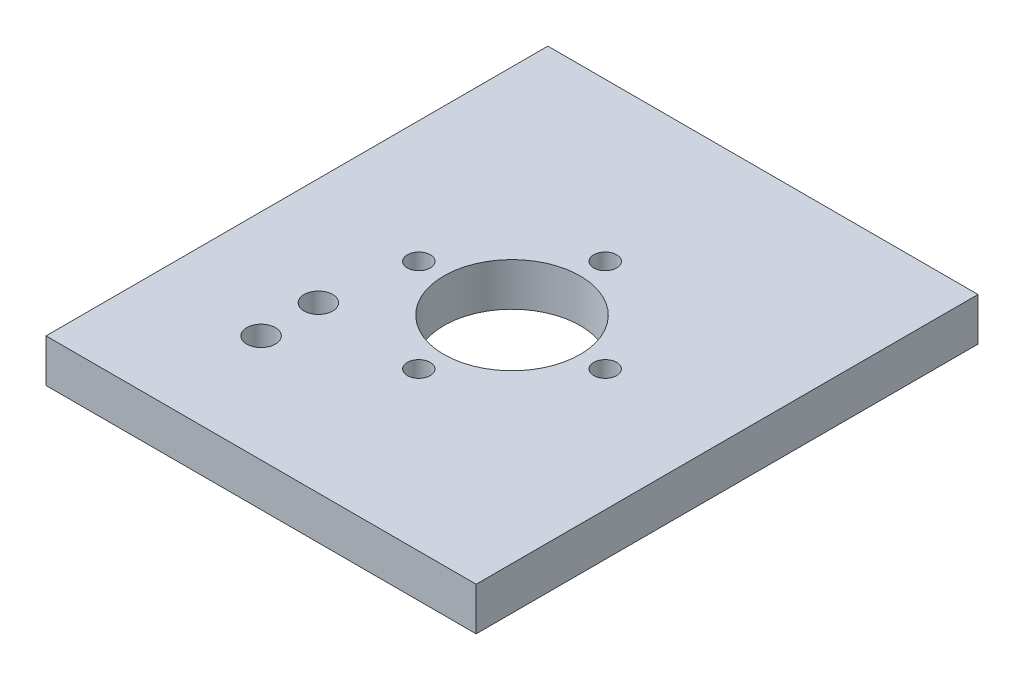
from build123d import *

# Parameters (mm, degrees)
SKETCH1_W                                       = 60
SKETCH1_H                                       = 70
SKETCH1_R                                       = 9.5
SKETCH1_R_2                                     = 2
BOSS_EXTRUDE1_DEPTH                             = 6
CSK_FOR_M3_FLAT_HEAD_MACHINE_SCREW1_D           = 3.2
CSK_FOR_M3_FLAT_HEAD_MACHINE_SCREW1_CSINK_D     = 6.3
CSK_FOR_M3_FLAT_HEAD_MACHINE_SCREW1_CSINK_ANGLE = 90


with BuildPart() as part:
    # Sketch1 → Boss-Extrude1 (new body)
    with BuildSketch(Plane(origin=(0, 0, 0), x_dir=(1, 0, 0), z_dir=(0, 1, 0))):
        Rectangle(SKETCH1_W, SKETCH1_H)
        Circle(SKETCH1_R, mode=Mode.SUBTRACT)
        with Locations((-15, -20)):
            Circle(SKETCH1_R_2, mode=Mode.SUBTRACT)
        with Locations((-15, -12)):
            Circle(SKETCH1_R_2, mode=Mode.SUBTRACT)
    extrude(amount=BOSS_EXTRUDE1_DEPTH)

    # CSK for M3 Flat Head Machine Screw1 (through all)
    with Locations(Plane(origin=(0, 0, 0), x_dir=(-1, 0, 0), z_dir=(0, -1, 0))):
        with Locations((-13, 0), (0, -13), (13, 0), (0, 13)):
            CounterSinkHole(CSK_FOR_M3_FLAT_HEAD_MACHINE_SCREW1_D / 2, CSK_FOR_M3_FLAT_HEAD_MACHINE_SCREW1_CSINK_D / 2, counter_sink_angle=CSK_FOR_M3_FLAT_HEAD_MACHINE_SCREW1_CSINK_ANGLE)


solid = part.part
